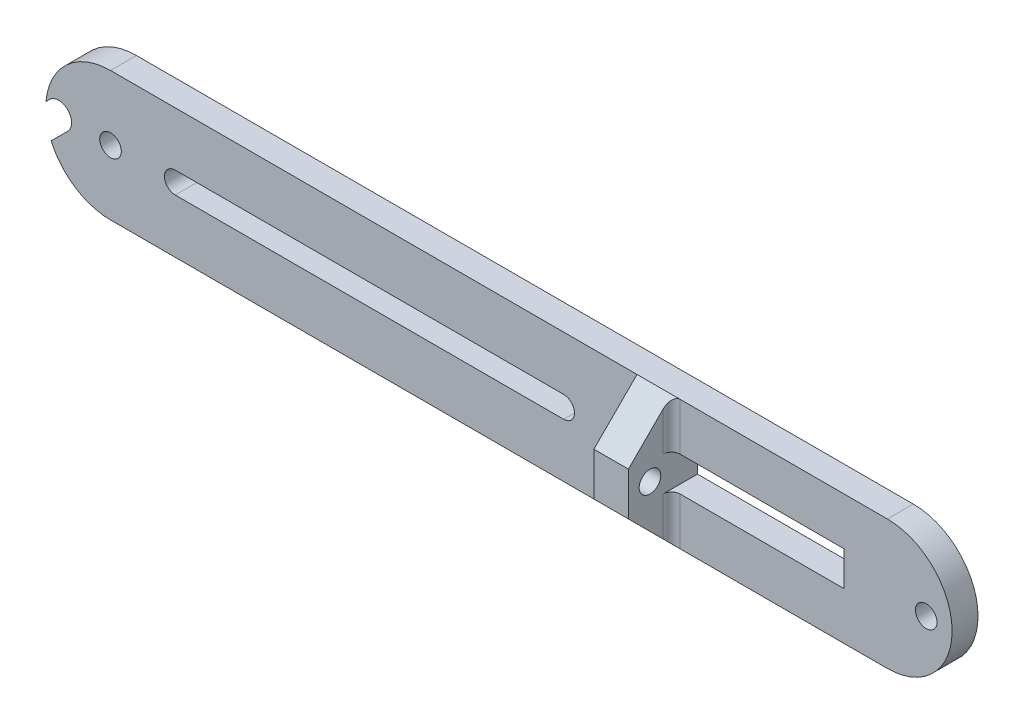
from build123d import *

# Parameters (mm, degrees)
ESQUISSE1_R             = 2.5
ESQUISSE1_W             = 40
ESQUISSE1_H             = 8
BOSS_EXTRU_1_DEPTH      = 6
ESQUISSE2_R             = 2.5
BOSS_EXTRU_2_DEPTH      = 8
CONG_2_R                = 2
ENL_V_MAT_EXTRU_1_DEPTH = 4
ENL_V_START             = -10
ENL_V_MAT_EXTRU_4_DEPTH = 10


with BuildPart() as part:
    # Esquisse1 → Boss.-Extru.1 (new body)
    with BuildSketch(Plane.XY):
        with BuildLine():
            Line((90, -15), (-90, -15))
            ThreePointArc((-90, -15), (-105, 0), (-90, 15))
            Line((-90, 15), (90, 15))
            ThreePointArc((90, 15), (105, 0), (90, -15))
        make_face()
        with Locations((99, 0)):
            Circle(ESQUISSE1_R, mode=Mode.SUBTRACT)
        with Locations((-90, 0)):
            Circle(ESQUISSE1_R, mode=Mode.SUBTRACT)
        with BuildLine():
            Line((15, -2.5), (-75, -2.5))
            ThreePointArc((-75, -2.5), (-77.5, 0), (-75, 2.5))
            Line((-75, 2.5), (15, 2.5))
            ThreePointArc((15, 2.5), (17.5, 0), (15, -2.5))
        make_face(mode=Mode.SUBTRACT)
        with Locations((60, 0)):
            Rectangle(ESQUISSE1_W, ESQUISSE1_H, mode=Mode.SUBTRACT)
    extrude(amount=BOSS_EXTRU_1_DEPTH)

    # Esquisse2 → Boss.-Extru.2 (add)
    with BuildSketch(Plane(origin=(40, 0, 0), x_dir=(0, 0, -1), z_dir=(1, 0, 0))):
        Polygon((-16, 5), (-16, -5), (-6, -15), (-6, -5), (-6, 5), (-6, 15), align=None)
        with Locations((-11, 0)):
            Circle(ESQUISSE2_R, mode=Mode.SUBTRACT)
    extrude(amount=-BOSS_EXTRU_2_DEPTH)

    # Congé2
    cong_2_edges = [part.edges().sort_by_distance(p)[0] for p in [
        (40, 9.5, 6),
        (40, -9.5, 6),
    ]]
    fillet(cong_2_edges, radius=CONG_2_R)

    # Esquisse3 → Enlèv. mat.-Extru.1 (cut)
    with BuildSketch(Plane.ZY.offset(-32)):
        Polygon((11, 4), (14.464101615, 2), (14.464101615, -2), (11, -4), (7.535898385, -2), (7.535898385, 2), align=None)
    extrude(amount=-ENL_V_MAT_EXTRU_1_DEPTH, mode=Mode.SUBTRACT)

    # Esquisse4 → Enlèv. mat.-Extru.4 (cut)
    with BuildSketch(Plane.XY.offset(6).offset(ENL_V_START)):
        with BuildLine():
            Line((-103.750652313, -5.993293), (-99.878679656, -2.121320344))
            ThreePointArc((-99.878679656, -2.121320344), (-99.878679656, 2.121320344), (-104.121320344, 2.121320344))
            Line((-104.121320344, 2.121320344), (-104.94364809, 1.298992597))
            ThreePointArc((-104.94364809, 1.298992597), (-104.803211685, -2.421760475), (-103.750652313, -5.993293))
        make_face()
    extrude(amount=ENL_V_MAT_EXTRU_4_DEPTH, mode=Mode.SUBTRACT)


solid = part.part
